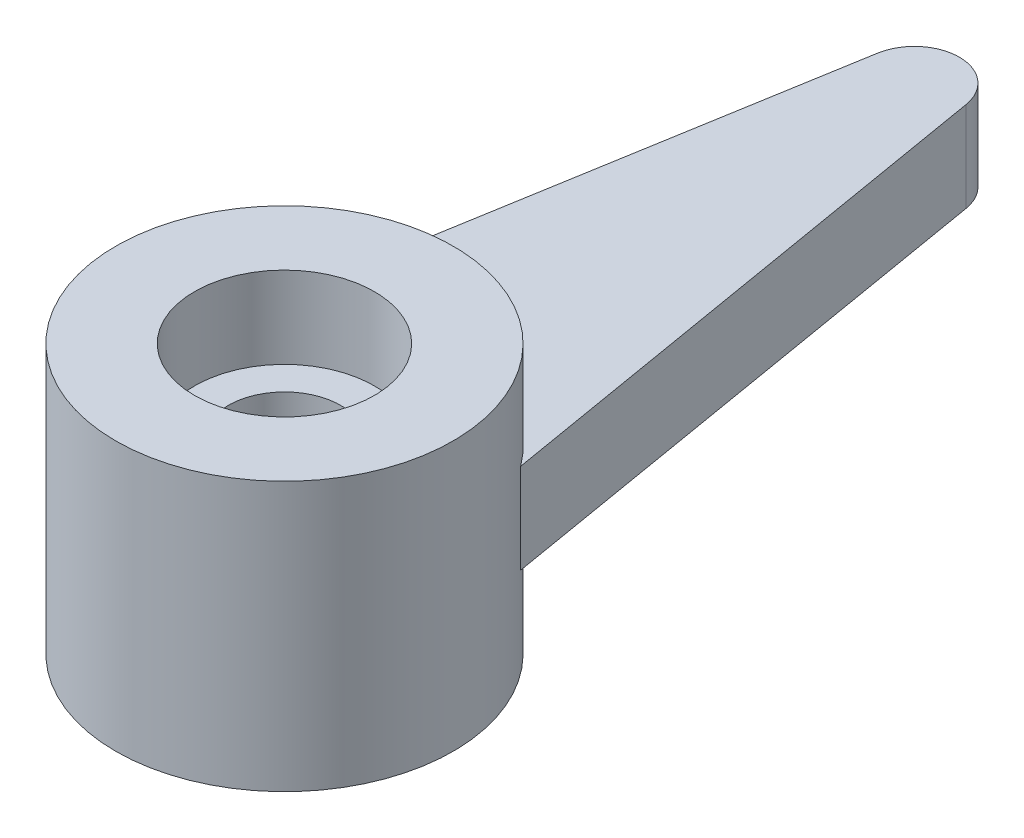
from build123d import *

# Parameters (mm, degrees)
SKETCH1_R                = 7.5
BOSS_EXTRUDE1_DEPTH      = 5.975
ROD_CUTOUT_DEPTH         = 16.978188258
ROD_CUTOUT_DEPTH_BACK    = 16.978188258
SKETCH2_R                = 2.5
SKETCH3_R                = 4
BEARING_CUTOUT_DEPTH     = 3.63
STEERINGLINK_MOUNT_DEPTH = 2
SKETCH5_R                = 2.5
CUT_EXTRUDE3_DEPTH       = 34.151960726


with BuildPart() as part:
    # Sketch1 → Boss-Extrude1 (new, symmetric)
    with BuildSketch(Plane(origin=(0, 0, 0), x_dir=(1, 0, 0), z_dir=(0, 1, 0))):
        Circle(SKETCH1_R)
    extrude(amount=BOSS_EXTRUDE1_DEPTH, both=True)

    # Sketch2 → Rod-Cutout (cut, two sides: drawn at the far end of the back side and taken through both)
    with BuildSketch(Plane(origin=(0, 5.975, 0), x_dir=(1, 0, 0), z_dir=(0, 1, 0)).offset(-ROD_CUTOUT_DEPTH_BACK)):
        Circle(SKETCH2_R)
    extrude(amount=ROD_CUTOUT_DEPTH + ROD_CUTOUT_DEPTH_BACK, mode=Mode.SUBTRACT)

    # Sketch3 → Bearing-Cutout (cut)
    with BuildSketch(Plane(origin=(0, 5.975, 0), x_dir=(1, 0, 0), z_dir=(0, 1, 0))):
        Circle(SKETCH3_R)
    bearing_cutout = extrude(amount=-BEARING_CUTOUT_DEPTH, mode=Mode.SUBTRACT)

    # Mirror1: Bearing-Cutout across plane
    add(bearing_cutout.mirror(Plane.ZX), mode=Mode.SUBTRACT)

    # Sketch4 → SteeringLink-Mount (add, symmetric)
    with BuildSketch(Plane(origin=(0, 0, 0), x_dir=(1, 0, 0), z_dir=(0, 1, 0))):
        with BuildLine():
            Line((-6, 0), (6, 0))
            Line((6, 0), (6, 4.5))
            Line((6, 4.5), (1.972034687, 28.333285452))
            ThreePointArc((1.972034687, 28.333285452), (0, 30), (-1.972034687, 28.333285452))
            Line((-1.972034687, 28.333285452), (-6, 4.5))
            Line((-6, 4.5), (-6, 0))
        make_face()
    extrude(amount=STEERINGLINK_MOUNT_DEPTH, both=True)

    # Sketch5 → Cut-Extrude3 (cut, through all)
    with BuildSketch(Plane(origin=(0, 5.975, 0), x_dir=(1, 0, 0), z_dir=(0, 1, 0))):
        Circle(SKETCH5_R)
    extrude(amount=-CUT_EXTRUDE3_DEPTH, mode=Mode.SUBTRACT)


solid = part.part
